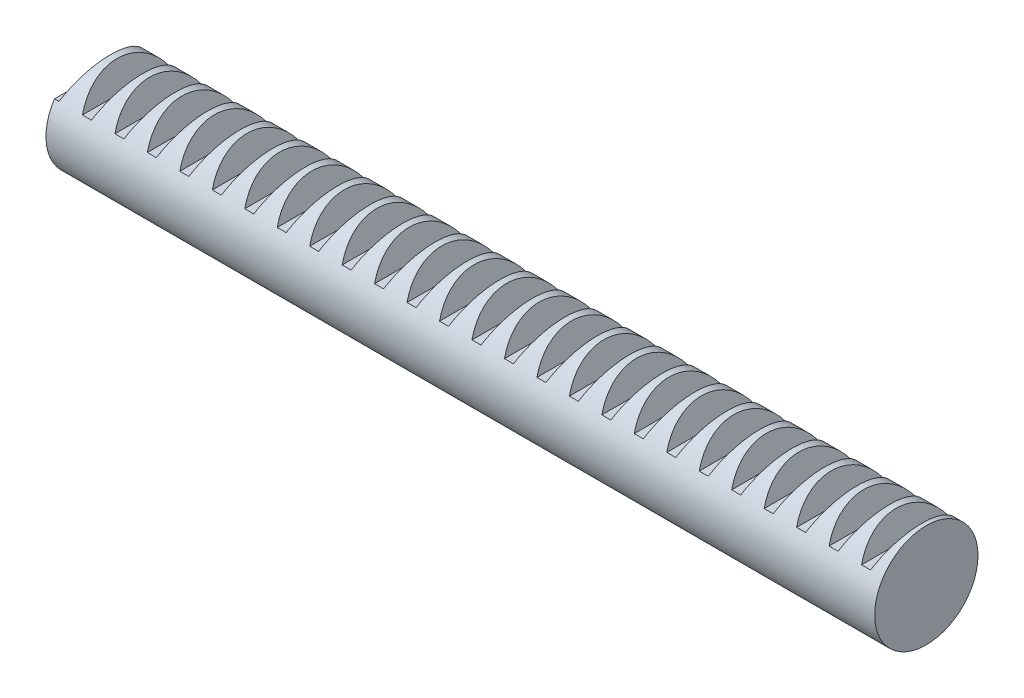
from build123d import *

# Parameters (mm, degrees)
BLANKSKE_W         = 500
BLANKSKE_H         = 27.5
BLANK_DEPTH        = 25
TOOTHCUTSIM_DEPTH  = 502.379347401
TEETHCUTS_COUNT    = 65
TEETHCUTS_PITCH    = 7.853981625
SKETCH1_W          = 500
SKETCH1_H          = 25
CUT_EXTRUDE1_DEPTH = 2.5
SKETCH2_R          = 21.615021809
SKETCH2_R_2        = 12.5
CUT_EXTRUDE2_DEPTH = 666.5
SKETCH3_R          = 12.55
CUT_EXTRUDE3_DEPTH = 299.5


with BuildPart() as part:
    # BlankSke → Blank (new body)
    with BuildSketch(Plane.XY):
        with Locations((250, 13.75)):
            Rectangle(BLANKSKE_W, BLANKSKE_H)
    extrude(amount=-BLANK_DEPTH)

    # TooCutSkeSim → ToothCutSim (cut, through all)
    with BuildSketch(Plane.XY):
        Polygon((1.087088424, 21.875), (-1.087088424, 21.875), (-3.143665836, 27.5254), (3.143665836, 27.5254), align=None)
    toothcutsim = extrude(amount=-TOOTHCUTSIM_DEPTH, mode=Mode.SUBTRACT)

    # TeethCuts: ToothCutSim ×65
    with Locations(*[(i * TEETHCUTS_PITCH, 0, 0) for i in range(1, TEETHCUTS_COUNT)]):
        add(toothcutsim, mode=Mode.SUBTRACT)

    # Sketch1 → Cut-Extrude1 (cut)
    with BuildSketch(Plane.XZ):
        with Locations((250, -12.5)):
            Rectangle(SKETCH1_W, SKETCH1_H)
    extrude(amount=-CUT_EXTRUDE1_DEPTH, mode=Mode.SUBTRACT)

    # Sketch2 → Cut-Extrude2 (cut)
    with BuildSketch(Plane(origin=(500, 0, 0), x_dir=(0, 0, -1), z_dir=(1, 0, 0))):
        with Locations((12.5, 15)):
            Circle(SKETCH2_R)
        with Locations((12.5, 15)):
            Circle(SKETCH2_R_2, mode=Mode.SUBTRACT)
    extrude(amount=-CUT_EXTRUDE2_DEPTH, mode=Mode.SUBTRACT)

    # Sketch3 → Cut-Extrude3 (cut)
    with BuildSketch(Plane(origin=(500, 66.081437247, 9.390114798), x_dir=(0, 0, 1), z_dir=(1, 0, 0))):
        with Locations((-21.890114798, 51.081437247)):
            Circle(SKETCH3_R)
    extrude(amount=-CUT_EXTRUDE3_DEPTH, mode=Mode.SUBTRACT)


solid = part.part
